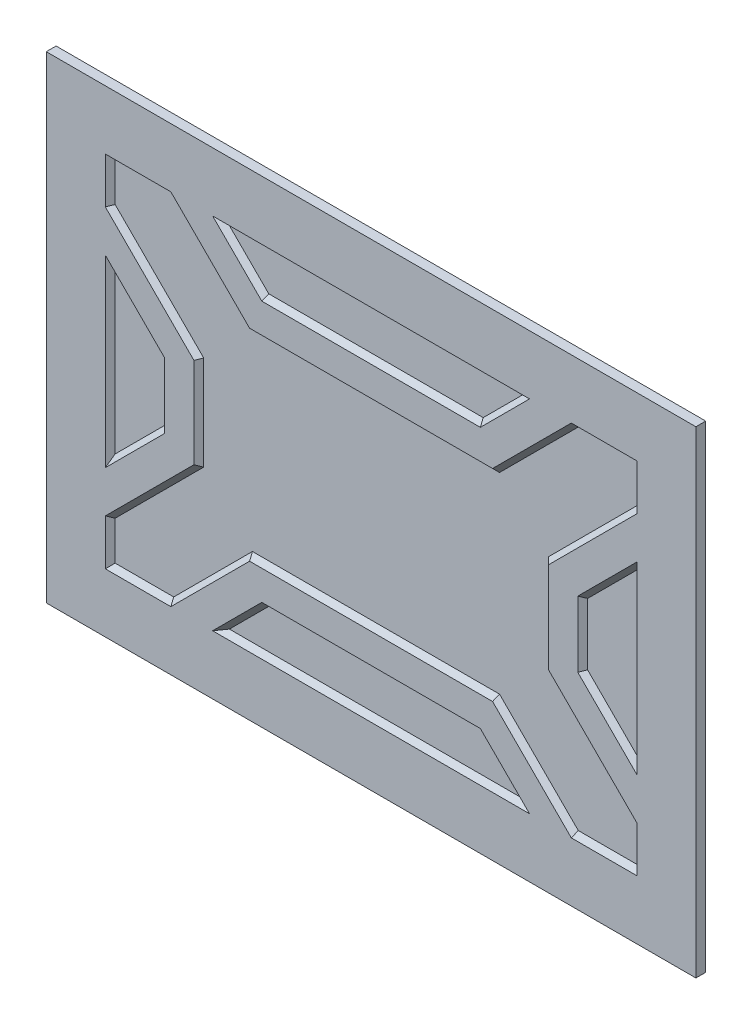
from build123d import *

# Parameters (mm, degrees)
ESQUISSE1_W             = 660
ESQUISSE1_H             = 485
BOSS_EXTRU_1_DEPTH      = 10
ENL_V_MAT_EXTRU_1_DEPTH = 5
CHANFREIN1_SIZE         = 5


with BuildPart() as part:
    # Esquisse1 → Boss.-Extru.1 (new body)
    with BuildSketch(Plane.XY):
        with Locations((330, 242.5)):
            Rectangle(ESQUISSE1_W, ESQUISSE1_H)
    extrude(amount=BOSS_EXTRU_1_DEPTH)

    # Esquisse2 → Enlèv. mat.-Extru.1 (cut)
    with BuildSketch(Plane.XY.offset(10)):
        Polygon((120, 208.994949366), (120, 276.005050634), (60, 336.005050634), (60, 148.994949366), align=None)
        Polygon((218.994949366, 375), (441.005050634, 375), (491.005050634, 425), (168.994949366, 425), align=None)
        Polygon((60, 425), (60, 378.431457505), (150, 288.431457505), (150, 196.568542495), (60, 106.568542495), (60, 60), (126.568542495, 60), (206.568542495, 140), (453.431457505, 140), (533.431457505, 60), (600, 60), (600, 106.568542495), (510, 196.568542495), (510, 288.431457505), (600, 378.431457505), (600, 425), (533.431457505, 425), (453.431457505, 345), (206.568542495, 345), (126.568542495, 425), align=None)
        Polygon((540, 208.994949366), (540, 276.005050634), (600, 336.005050634), (600, 148.994949366), align=None)
        Polygon((491.005050634, 60), (168.994949366, 60), (218.994949366, 110), (441.005050634, 110), align=None)
    extrude(amount=-ENL_V_MAT_EXTRU_1_DEPTH, mode=Mode.SUBTRACT)

    # Chanfrein1
    chanfrein1_edges = [part.edges().sort_by_distance(p)[0] for p in [
        (330, 60, 5),
        (193.994949366, 85, 5),
        (330, 110, 5),
        (466.005050634, 85, 5),
        (60, 242.5, 5),
        (90, 306.005050634, 5),
        (120, 242.5, 5),
        (90, 178.994949366, 5),
        (600, 242.5, 5),
        (570, 178.994949366, 5),
        (540, 242.5, 5),
        (570, 306.005050634, 5),
        (166.568542495, 385, 5),
        (330, 345, 5),
        (493.431457505, 385, 5),
        (566.715728753, 425, 5),
        (600, 401.715728753, 5),
        (555, 333.431457505, 5),
        (510, 242.5, 5),
        (555, 151.568542495, 5),
        (600, 83.284271247, 5),
        (566.715728753, 60, 5),
        (493.431457505, 100, 5),
        (330, 140, 5),
        (166.568542495, 100, 5),
        (93.284271247, 60, 5),
        (60, 83.284271247, 5),
        (105, 151.568542495, 5),
        (150, 242.5, 5),
        (105, 333.431457505, 5),
        (60, 401.715728753, 5),
        (93.284271247, 425, 5),
        (330, 425, 5),
        (466.005050634, 400, 5),
        (330, 375, 5),
        (193.994949366, 400, 5),
    ]]
    chamfer(chanfrein1_edges, length=CHANFREIN1_SIZE - 0.0001)  # a hair under: the kernel refuses the full size


solid = part.part
